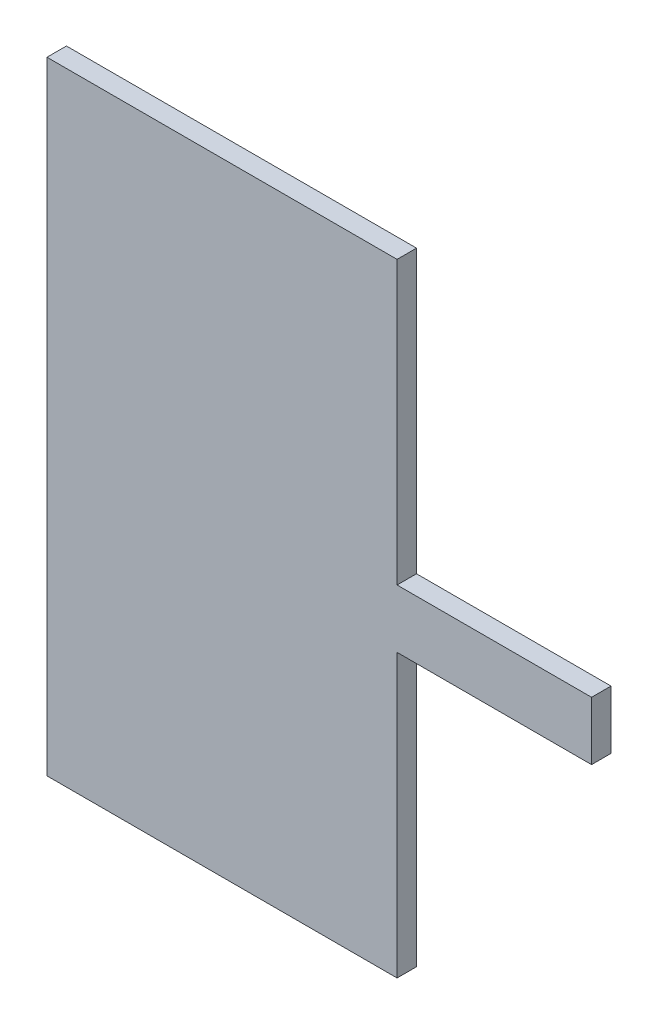
from build123d import *

# Parameters (mm, degrees)
BOSS_EXTRUDE1_DEPTH = 1


with BuildPart() as part:
    # Sketch1 → Boss-Extrude1 (new body)
    with BuildSketch(Plane.XY):
        Polygon((29.736292646, -7), (11.736292646, -7), (11.736292646, 25), (29.736292646, 25), (29.736292646, 10.5), (39.736292646, 10.5), (39.736292646, 7.5), (29.736292646, 7.5), align=None)
    extrude(amount=BOSS_EXTRUDE1_DEPTH)


solid = part.part
